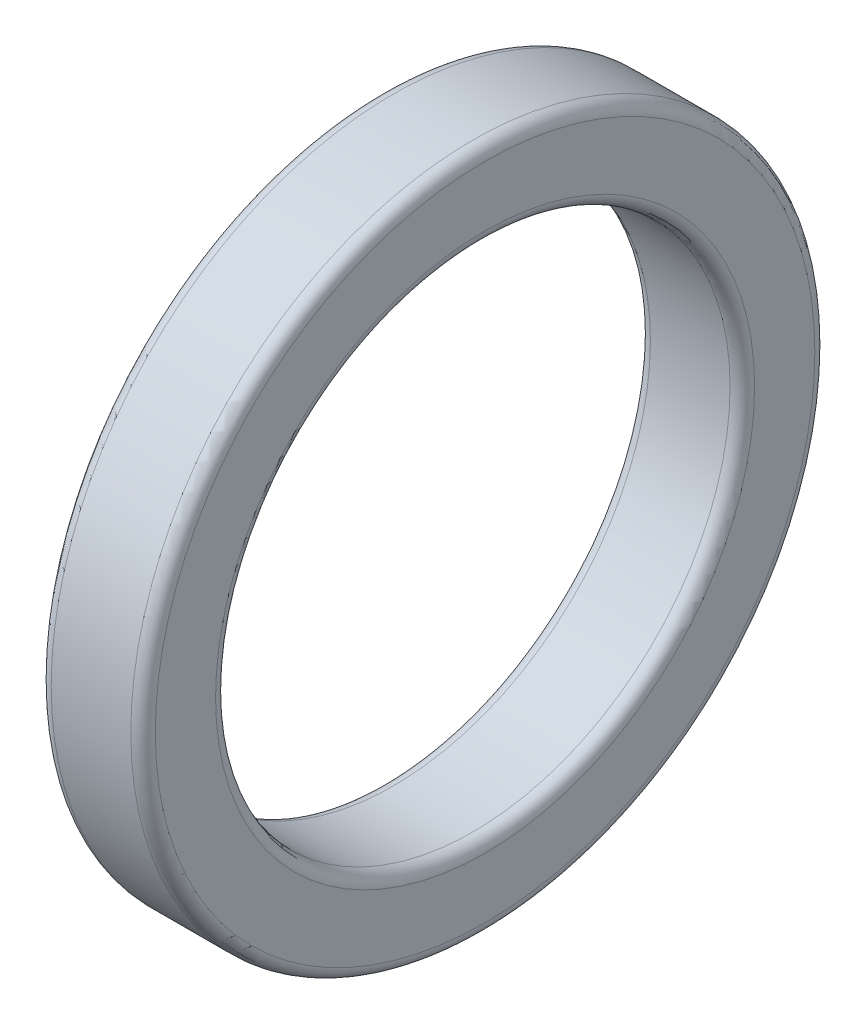
from build123d import *

# Parameters (mm, degrees)
SKETCH3_R           = 279.2
SKETCH3_R_2         = 210
BOSS_EXTRUDE1_DEPTH = 42.5
FILLET1_R           = 10


with BuildPart() as part:
    # Sketch3 → Boss-Extrude1 (new, symmetric)
    with BuildSketch(Plane(origin=(0, 0, 0), x_dir=(0, 0, -1), z_dir=(1, 0, 0))):
        Circle(SKETCH3_R)
        Circle(SKETCH3_R_2, mode=Mode.SUBTRACT)
    extrude(amount=BOSS_EXTRUDE1_DEPTH, both=True)

    # Fillet1
    fillet1_edges = [part.edges().sort_by_distance(p)[0] for p in [
        (-42.5, 0, 210),
        (-42.5, 0, 279.2),
        (42.5, 0, 210),
        (42.5, 0, 279.2),
    ]]
    fillet(fillet1_edges, radius=FILLET1_R)


solid = part.part
